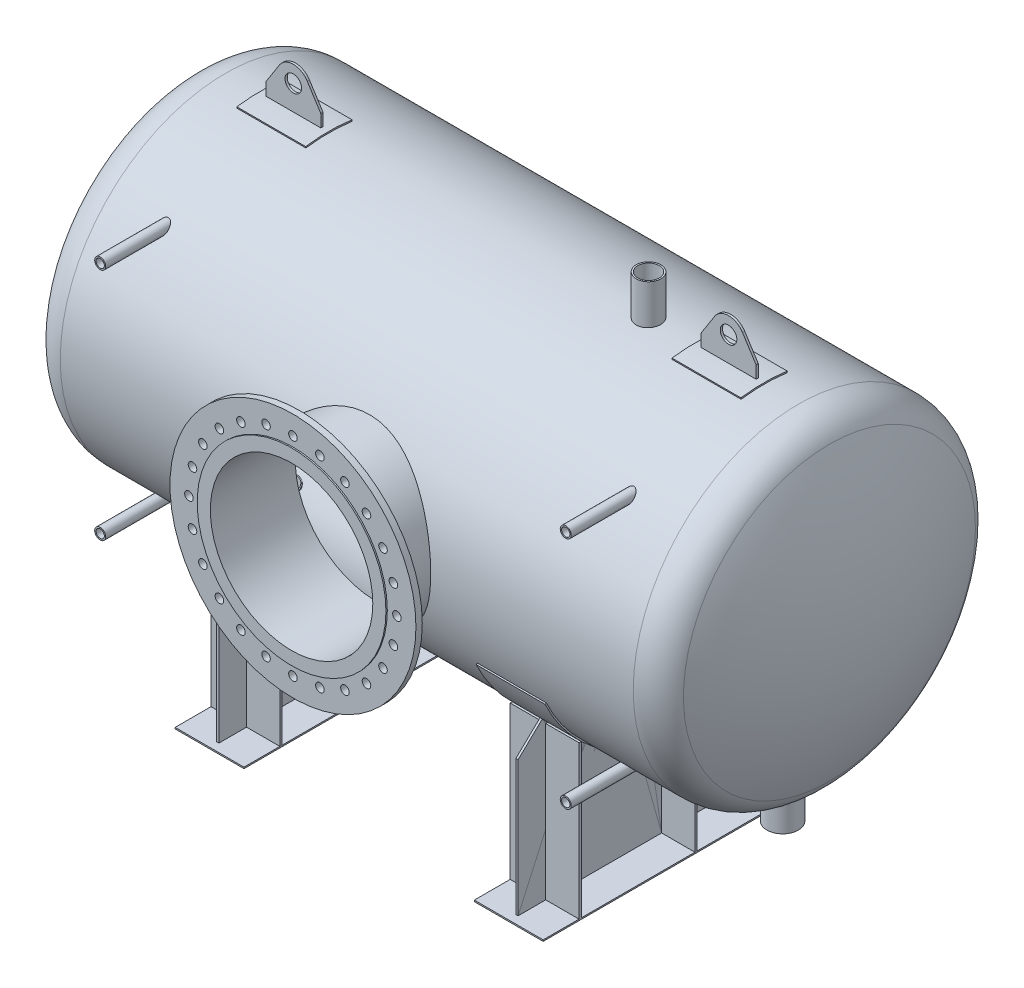
from build123d import *

# Parameters (mm, degrees)
SKETCH2_R                  = 57
SKETCH2_R_2                = 53.4
SKETCH2_R_3                = 96.050737487
SKETCH2_R_4                = 89.550737487
BOSS_EXTRUDE4_DEPTH        = 151
SKETCH2_3_R                = 89.550737487
SKETCH2_3_R_2              = 53.4
CUT_EXTRUDE2_DEPTH         = 171
SKETCH7_W                  = 250
SKETCH7_H                  = 5
REVOLVE2_ANGLE             = 65
REVOLVE2_OTHER_WAY_ANGLE   = 65
SKETCH8_W                  = 250
SKETCH8_H                  = 5
REVOLVE3_ANGLE             = 8
REVOLVE3_OTHER_WAY_ANGLE   = 8
SKETCH9_R                  = 30
BOSS_EXTRUDE5_DEPTH        = 4
BOSS_EXTRUDE5_2_DEPTH      = 4
BOSS_EXTRUDE6_DEPTH        = 555
BOSS_EXTRUDE6_DEPTH_BACK   = 555
SKETCH10_W                 = 250
SKETCH10_H                 = 5
BOSS_EXTRUDE6_2_DEPTH      = 555
BOSS_EXTRUDE6_2_DEPTH_BACK = 555
SKETCH11_R                 = 44.5
SKETCH11_R_2               = 39
BOSS_EXTRUDE7_DEPTH        = 169.5
SKETCH11_2_R               = 39
CUT_EXTRUDE3_DEPTH         = 189.5
SKETCH13_R                 = 294.9
CUT_EXTRUDE4_DEPTH         = 544.5
BOSS_EXTRUDE8_DEPTH        = 4
BOSS_EXTRUDE14_START       = -4
SKETCH15_W                 = 8
SKETCH15_H                 = 554.381589534
BOSS_EXTRUDE14_DEPTH       = 125
BOSS_EXTRUDE14_2_DEPTH     = 125
SKETCH15_H_2               = 388.013223285
BOSS_EXTRUDE14_3_DEPTH     = 125
MIRROR2_START              = 539
MIRROR2_DEPTH              = 8
MIRROR2_START_2            = 418
MIRROR2_2_OUTLINE_W        = 554.381589534
MIRROR2_2_OUTLINE_H        = 8
MIRROR2_2_OUTLINE_W_2      = 388.013223285
MIRROR2_2_DEPTH            = 250
MIRROR2_3_DEPTH            = 8
MIRROR2_4_DEPTH            = 250
SKETCH16_R                 = 15.557652857
CUT_EXTRUDE5_DEPTH         = 23
CIRPATTERN1_START          = 772.3
CIRPATTERN1_OUTLINE_R      = 15.557652857
CIRPATTERN1_DEPTH          = 23
SKETCH17_R                 = 20
SKETCH17_R_2               = 15
BOSS_EXTRUDE15_DEPTH       = 280
SKETCH17_2_R               = 15
CUT_EXTRUDE6_DEPTH         = 280


# Read off the part's stored shape, not the designer's step: Mirror2, CirPattern1
with BuildPart() as part:
    # Sketch1 → Revolve1 (revolve)
    with BuildSketch(Plane.XY, mode=Mode.PRIVATE) as revolve1_sk:
        with BuildLine():
            Line((-1000, 595), (-1040, 595))
            ThreePointArc((-1040, 595), (-1103.508529611, 576.816828995), (-1147.770618319, 527.777777778))
            ThreePointArc((-1147.770618319, 527.777777778), (-1239.091256855, 270.880582705), (-1270.06443513, 0))
            Line((-1270.06443513, 0), (-1275.06443513, 0))
            ThreePointArc((-1275.06443513, 0), (-1243.962201946, 272.0092518), (-1152.261060749, 529.976851852))
            ThreePointArc((-1152.261060749, 529.976851852), (-1106.154718345, 581.05919687), (-1040, 600))
            Line((-1040, 600), (-1000, 600))
            Line((-1000, 600), (1000, 600))
            Line((1000, 600), (1040, 600))
            ThreePointArc((1040, 600), (1106.154718345, 581.05919687), (1152.261060749, 529.976851852))
            ThreePointArc((1152.261060749, 529.976851852), (1243.962201946, 272.0092518), (1275.06443513, 0))
            Line((1275.06443513, 0), (1270.06443513, 0))
            ThreePointArc((1270.06443513, 0), (1239.091256855, 270.880582705), (1147.770618319, 527.777777778))
            ThreePointArc((1147.770618319, 527.777777778), (1103.508529611, 576.816828995), (1040, 595))
            Line((1040, 595), (1000, 595))
            Line((1000, 595), (-1000, 595))
        make_face()
    revolve(revolve1_sk.sketch.rotate(Axis((0, 0, 0), (-1, 0, 0)), 90), axis=Axis((0, 0, 0), (-1, 0, 0)))

    # Sketch2 → Boss-Extrude4 (add)
    # profile 1 of 4: a face of its own
    with BuildSketch(Plane(origin=(0, -740, 0), x_dir=(1, 0, 0), z_dir=(0, 1, 0))):
        with Locations(Location((-842, 0, 0), (0, 0, 90))):
            Circle(SKETCH2_R)
        with Locations(Location((-842, 0, 0), (0, 0, 90))):
            Circle(SKETCH2_R_2, mode=Mode.SUBTRACT)
    # profile 2 of 4: a face of its own
    with BuildSketch(Plane(origin=(0, -740, 0), x_dir=(1, 0, 0), z_dir=(0, 1, 0))):
        with Locations(Location((-242, 0, 0), (0, 0, 90))):
            Circle(SKETCH2_R)
        with Locations(Location((-242, 0, 0), (0, 0, 90))):
            Circle(SKETCH2_R_2, mode=Mode.SUBTRACT)
    # profile 3 of 4: a face of its own
    with BuildSketch(Plane(origin=(0, -740, 0), x_dir=(1, 0, 0), z_dir=(0, 1, 0))):
        with Locations(Location((158, 0, 0), (0, 0, 90))):
            Circle(SKETCH2_R_3)
        with Locations(Location((158, 0, 0), (0, 0, 90))):
            Circle(SKETCH2_R_4, mode=Mode.SUBTRACT)
    # profile 4 of 4: a face of its own
    with BuildSketch(Plane(origin=(0, -740, 0), x_dir=(1, 0, 0), z_dir=(0, 1, 0))):
        with Locations(Location((982.261060749, 0, 0), (0, 0, 90))):
            Circle(SKETCH2_R)
        with Locations(Location((982.261060749, 0, 0), (0, 0, 90))):
            Circle(SKETCH2_R_2, mode=Mode.SUBTRACT)
    extrude(amount=BOSS_EXTRUDE4_DEPTH)

    # Sketch2<3> → Cut-Extrude2 (cut)
    with BuildSketch(Plane(origin=(0, -740, 0), x_dir=(1, 0, 0), z_dir=(0, 1, 0))):
        with Locations(Location((158, 0, 0), (0, 0, 70.2542109))):
            Circle(SKETCH2_3_R)
        with Locations(Location((982.261060749, 0, 0), (0, 0, 270))):
            Circle(SKETCH2_3_R_2)
        with Locations(Location((-242, 0, 0), (0, 0, 270))):
            Circle(SKETCH2_3_R_2)
        with Locations(Location((-842, 0, 0), (0, 0, 270))):
            Circle(SKETCH2_3_R_2)
    extrude(amount=CUT_EXTRUDE2_DEPTH, mode=Mode.SUBTRACT)

    # Sketch7 → Revolve2 (revolve)
    with BuildSketch(Plane.XY):
        with Locations((-543, -602.5)):
            Rectangle(SKETCH7_W, SKETCH7_H)
        with Locations((543, -602.5)):
            Rectangle(SKETCH7_W, SKETCH7_H)
    revolve(axis=Axis((0, 0, 0), (1, 0, 0)), revolution_arc=REVOLVE2_ANGLE)

    # Sketch7 → Revolve2 other way (revolve)
    with BuildSketch(Plane.XY):
        with Locations((-543, -602.5)):
            Rectangle(SKETCH7_W, SKETCH7_H)
        with Locations((543, -602.5)):
            Rectangle(SKETCH7_W, SKETCH7_H)
    revolve(axis=Axis((0, 0, 0), (-1, 0, 0)), revolution_arc=REVOLVE2_OTHER_WAY_ANGLE)

    # Sketch8 → Revolve3 (revolve)
    with BuildSketch(Plane.XY):
        with Locations((790, 602.5)):
            Rectangle(SKETCH8_W, SKETCH8_H)
        with Locations((-790, 602.5)):
            Rectangle(SKETCH8_W, SKETCH8_H)
    revolve(axis=Axis((0, 0, 0), (1, 0, 0)), revolution_arc=REVOLVE3_ANGLE)

    # Sketch8 → Revolve3 other way (revolve)
    with BuildSketch(Plane.XY):
        with Locations((790, 602.5)):
            Rectangle(SKETCH8_W, SKETCH8_H)
        with Locations((-790, 602.5)):
            Rectangle(SKETCH8_W, SKETCH8_H)
    revolve(axis=Axis((0, 0, 0), (-1, 0, 0)), revolution_arc=REVOLVE3_OTHER_WAY_ANGLE)

    # Sketch11 → Boss-Extrude7 (add)
    with BuildSketch(Plane(origin=(0, 743.5, 0), x_dir=(1, 0, 0), z_dir=(0, 1, 0))):
        with Locations(Location((495.5, 0, 0), (0, 0, 270))):
            Circle(SKETCH11_R)
        with Locations(Location((495.5, 0, 0), (0, 0, 270))):
            Circle(SKETCH11_R_2, mode=Mode.SUBTRACT)
    extrude(amount=-BOSS_EXTRUDE7_DEPTH)

    # Sketch11<2> → Cut-Extrude3 (cut)
    with BuildSketch(Plane(origin=(0, 743.5, 0), x_dir=(1, 0, 0), z_dir=(0, 1, 0))):
        with Locations(Location((495.5, 0, 0), (0, 0, 270))):
            Circle(SKETCH11_2_R)
    extrude(amount=-CUT_EXTRUDE3_DEPTH, mode=Mode.SUBTRACT)

    # Sketch12 → Revolve4 (revolve)
    with BuildSketch(Plane(origin=(0, 0, 0), x_dir=(0, 0, -1), z_dir=(1, 0, 0)), mode=Mode.PRIVATE) as revolve4_sk:
        Polygon((-491.8, 294.9), (-800.3, 294.9), (-800.3, 342.6), (-795.3, 342.6), (-795.3, 446.473922648), (-772.3, 446.473922648), (-772.3, 329.9), (-738.3, 305.446942321), (-727.673655082, 305.446942321), (-721.673655082, 298.745663061), (-718.673655082, 298.745663061), (-711.8, 304.9), (-491.8, 304.9), align=None)
    revolve(revolve4_sk.sketch.rotate(Axis((0, 0, 0), (0, 0, -1)), 90), axis=Axis((0, 0, 0), (0, 0, -1)))

    # Sketch13 → Cut-Extrude4 (cut)
    with BuildSketch(Plane.XY.offset(800.3)):
        Circle(SKETCH13_R)
    extrude(amount=-CUT_EXTRUDE4_DEPTH, mode=Mode.SUBTRACT)



with BuildPart() as body_2:
    # Sketch9 → Boss-Extrude5 (new, symmetric)
    with BuildSketch(Plane.XY):
        with BuildLine():
            Line((690, 605), (890, 605))
            Line((890, 605), (890, 650))
            Line((890, 650), (840.546948577, 727.326552393))
            ThreePointArc((840.546948577, 727.326552393), (790, 755), (739.453051423, 727.326552393))
            Line((739.453051423, 727.326552393), (690, 650))
            Line((690, 650), (690, 605))
        make_face()
        with Locations((790, 695)):
            Circle(SKETCH9_R, mode=Mode.SUBTRACT)
    extrude(amount=BOSS_EXTRUDE5_DEPTH, both=True)


with BuildPart() as body_3:
    # Sketch9 → Boss-Extrude5 2 (new, symmetric)
    with BuildSketch(Plane.XY):
        with BuildLine():
            Line((-690, 650), (-739.453051423, 727.326552393))
            ThreePointArc((-739.453051423, 727.326552393), (-790, 755), (-840.546948577, 727.326552393))
            Line((-840.546948577, 727.326552393), (-890, 650))
            Line((-890, 650), (-890, 605))
            Line((-890, 605), (-690, 605))
            Line((-690, 605), (-690, 650))
        make_face()
        with Locations(Location((-790, 695, 0), (0, 0, 180))):
            Circle(SKETCH9_R, mode=Mode.SUBTRACT)
    extrude(amount=BOSS_EXTRUDE5_2_DEPTH, both=True)


with BuildPart() as body_4:
    # Sketch10 → Boss-Extrude6 (new, two sides: drawn at the far end of the back side and taken through both)
    with BuildSketch(Plane.XY.offset(-BOSS_EXTRUDE6_DEPTH_BACK)):
        with Locations((-543, -995.5)):
            Rectangle(SKETCH10_W, SKETCH10_H)
    extrude(amount=BOSS_EXTRUDE6_DEPTH + BOSS_EXTRUDE6_DEPTH_BACK)


with BuildPart() as body_5:
    # Sketch10 → Boss-Extrude6 2 (new, two sides: drawn at the far end of the back side and taken through both)
    with BuildSketch(Plane.XY.offset(-BOSS_EXTRUDE6_2_DEPTH_BACK)):
        with Locations((543, -995.5)):
            Rectangle(SKETCH10_W, SKETCH10_H)
    extrude(amount=BOSS_EXTRUDE6_2_DEPTH + BOSS_EXTRUDE6_2_DEPTH_BACK)

    # Mirror2 outline → Mirror2 (add)
    with BuildSketch(Plane.YZ.offset(MIRROR2_START)):
        with BuildLine():
            ThreePointArc((-418.133845854, -437.251743223), (-555.536425748, -239.59190234), (-604.986776715, -3.999999999))
            Line((-604.986776715, -3.999999999), (-604.986776715, 3.999999999))
            ThreePointArc((-604.986776715, 3.999999999), (-555.536425748, 239.59190234), (-418.133845854, 437.251743223))
            Line((-418.133845854, 437.251743223), (-502.045497762, 525))
            Line((-502.045497762, 525), (-993, 525))
            Line((-993, 525), (-993, -525))
            Line((-993, -525), (-502.045497762, -525))
            Line((-502.045497762, -525), (-418.133845854, -437.251743223))
        make_face()
    extrude(amount=MIRROR2_DEPTH)

    # Mirror2 2 outline → Mirror2 2 (add)
    with BuildSketch(Plane.YZ.offset(MIRROR2_START_2)):
        with Locations((-715.809205233, -420.7)):
            Rectangle(MIRROR2_2_OUTLINE_W, MIRROR2_2_OUTLINE_H)
        with Locations((-798.993388358, 0)):
            Rectangle(MIRROR2_2_OUTLINE_W_2, MIRROR2_2_OUTLINE_H)
        with Locations((-715.809205233, 420.7)):
            Rectangle(MIRROR2_2_OUTLINE_W, MIRROR2_2_OUTLINE_H)
    extrude(amount=MIRROR2_2_DEPTH)


with BuildPart() as part_1:
    add(part.part)

    add(body_4.part)  # Boss-Extrude8 merges body 4
    # Sketch14 → Boss-Extrude8 (add, symmetric)
    with BuildSketch(Plane.ZY.offset(543)):
        with BuildLine():
            Line((-525, -993), (-525, -502.045497762))
            Line((-525, -502.045497762), (-437.251743223, -418.133845854))
            ThreePointArc((-437.251743223, -418.133845854), (0, -605), (437.251743223, -418.133845854))
            Line((437.251743223, -418.133845854), (525, -502.045497762))
            Line((525, -502.045497762), (525, -993))
            Line((525, -993), (0, -993))
            Line((0, -993), (-525, -993))
        make_face()
    extrude(amount=BOSS_EXTRUDE8_DEPTH, both=True)

    # Mirror2 3 outline → Mirror2 3 (add)
    with BuildSketch(Plane.YZ.offset(MIRROR2_START)):
        with BuildLine():
            ThreePointArc((-418.133845854, -437.251743223), (-605, 0), (-418.133845854, 437.251743223))
            Line((-418.133845854, 437.251743223), (-502.045497762, 525))
            Line((-502.045497762, 525), (-993, 525))
            Line((-993, 525), (-993, -525))
            Line((-993, -525), (-502.045497762, -525))
            Line((-502.045497762, -525), (-418.133845854, -437.251743223))
        make_face()
    extrude(amount=MIRROR2_3_DEPTH)

    # Mirror2 4 outline → Mirror2 4 (add)
    with BuildSketch(Plane.YZ.offset(MIRROR2_START_2)):
        with BuildLine():
            Line((-993, -4), (-604.986776715, -4))
            ThreePointArc((-604.986776715, -4), (-605, 0), (-604.986776715, 4))
            Line((-604.986776715, 4), (-993, 4))
            Line((-993, 4), (-993, -4))
        make_face()
    extrude(amount=MIRROR2_4_DEPTH)

    # Sketch16 → Cut-Extrude5 (cut)
    with BuildSketch(Plane.XY.offset(795.3)):
        with Locations((0, 377.5)):
            Circle(SKETCH16_R)
    extrude(amount=-CUT_EXTRUDE5_DEPTH, mode=Mode.SUBTRACT)

    # CirPattern1 outline → CirPattern1 (cut)
    with BuildSketch(Plane.XY.offset(CIRPATTERN1_START)):
        with Locations((-97.704189526, 364.636999424)):
            Circle(CIRPATTERN1_OUTLINE_R)
        with Locations((97.704189526, 364.636999424)):
            Circle(CIRPATTERN1_OUTLINE_R)
        with Locations((188.75, 326.924589929)):
            Circle(CIRPATTERN1_OUTLINE_R)
        with Locations((266.932809898, 266.932809898)):
            Circle(CIRPATTERN1_OUTLINE_R)
        with Locations((326.924589929, 188.75)):
            Circle(CIRPATTERN1_OUTLINE_R)
        with Locations((364.636999424, 97.704189526)):
            Circle(CIRPATTERN1_OUTLINE_R)
        with Locations((377.5, 0)):
            Circle(CIRPATTERN1_OUTLINE_R)
        with Locations((364.636999424, -97.704189526)):
            Circle(CIRPATTERN1_OUTLINE_R)
        with Locations((326.924589929, -188.75)):
            Circle(CIRPATTERN1_OUTLINE_R)
        with Locations((266.932809898, -266.932809898)):
            Circle(CIRPATTERN1_OUTLINE_R)
        with Locations((188.75, -326.924589929)):
            Circle(CIRPATTERN1_OUTLINE_R)
        with Locations((97.704189526, -364.636999424)):
            Circle(CIRPATTERN1_OUTLINE_R)
        with Locations((0, -377.5)):
            Circle(CIRPATTERN1_OUTLINE_R)
        with Locations((-97.704189526, -364.636999424)):
            Circle(CIRPATTERN1_OUTLINE_R)
        with Locations((-188.75, -326.924589929)):
            Circle(CIRPATTERN1_OUTLINE_R)
        with Locations((-266.932809898, -266.932809898)):
            Circle(CIRPATTERN1_OUTLINE_R)
        with Locations((-326.924589929, -188.75)):
            Circle(CIRPATTERN1_OUTLINE_R)
        with Locations((-364.636999424, -97.704189526)):
            Circle(CIRPATTERN1_OUTLINE_R)
        with Locations((-377.5, 0)):
            Circle(CIRPATTERN1_OUTLINE_R)
        with Locations((-364.636999424, 97.704189526)):
            Circle(CIRPATTERN1_OUTLINE_R)
        with Locations((-326.924589929, 188.75)):
            Circle(CIRPATTERN1_OUTLINE_R)
        with Locations((-266.932809898, 266.932809898)):
            Circle(CIRPATTERN1_OUTLINE_R)
        with Locations((-188.75, 326.924589929)):
            Circle(CIRPATTERN1_OUTLINE_R)
    extrude(amount=CIRPATTERN1_DEPTH, mode=Mode.SUBTRACT)

    # Sketch17 → Boss-Extrude15 (add)
    # profile 1 of 2: a face of its own
    with BuildSketch(Plane.XY.offset(650)):
        with Locations((-845, 425)):
            Circle(SKETCH17_R)
        with Locations((-845, 425)):
            Circle(SKETCH17_R_2, mode=Mode.SUBTRACT)
    # profile 2 of 2: a face of its own
    with BuildSketch(Plane.XY.offset(650)):
        with Locations((-845, -425)):
            Circle(SKETCH17_R)
        with Locations((-845, -425)):
            Circle(SKETCH17_R_2, mode=Mode.SUBTRACT)
    boss_extrude15 = extrude(amount=-BOSS_EXTRUDE15_DEPTH)

    # Sketch17<2> → Cut-Extrude6 (cut)
    with BuildSketch(Plane.XY.offset(650)):
        with Locations((-845, 425)):
            Circle(SKETCH17_2_R)
        with Locations(Location((-845, -425, 0), (0, 0, 180))):
            Circle(SKETCH17_2_R)
    cut_extrude6 = extrude(amount=-CUT_EXTRUDE6_DEPTH, mode=Mode.SUBTRACT)

    # Mirror4: Boss-Extrude15, Cut-Extrude6 across plane
    add(boss_extrude15.mirror(Plane(origin=(0, 0, 0), x_dir=(0, 0, 1), z_dir=(1, 0, 0))))
    add(cut_extrude6.mirror(Plane(origin=(0, 0, 0), x_dir=(0, 0, 1), z_dir=(1, 0, 0))), mode=Mode.SUBTRACT)


with BuildPart() as body_5_2:
    # Sketch15 → Boss-Extrude14 (new body)
    with BuildSketch(Plane.ZY.offset(547).offset(BOSS_EXTRUDE14_START)):
        with Locations((-420.7, -715.809205233)):
            Rectangle(SKETCH15_W, SKETCH15_H)
    boss_extrude14 = extrude(amount=BOSS_EXTRUDE14_DEPTH)


with BuildPart() as body_6:
    # Sketch15 → Boss-Extrude14 2 (new body)
    with BuildSketch(Plane.ZY.offset(547).offset(BOSS_EXTRUDE14_START)):
        with Locations((420.7, -715.809205233)):
            Rectangle(SKETCH15_W, SKETCH15_H)
    boss_extrude14_2 = extrude(amount=BOSS_EXTRUDE14_2_DEPTH)


with BuildPart() as body_7:
    # Sketch15 → Boss-Extrude14 3 (new body)
    with BuildSketch(Plane.ZY.offset(547).offset(BOSS_EXTRUDE14_START)):
        with Locations((0, -798.993388358)):
            Rectangle(SKETCH15_W, SKETCH15_H_2)
    boss_extrude14_3 = extrude(amount=BOSS_EXTRUDE14_3_DEPTH)


with BuildPart() as body_5_2_1:
    add(body_5_2.part)

    add(body_6.part)  # Mirror1 merges body 6

    add(body_7.part)  # Mirror1 merges body 7
    # Mirror1: Boss-Extrude14, Boss-Extrude14 2, Boss-Extrude14 3 across plane
    add(boss_extrude14.mirror(Plane.ZY.offset(543)))
    add(boss_extrude14_2.mirror(Plane.ZY.offset(543)))
    add(boss_extrude14_3.mirror(Plane.ZY.offset(543)))


solid = Compound([body_2.part, body_3.part, body_5.part, part_1.part, body_5_2_1.part])
